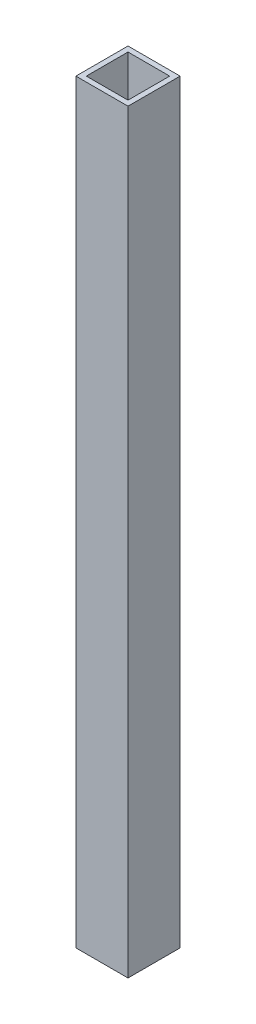
from build123d import *

# Parameters (mm, degrees)
SKETCH1_W           = 15
SKETCH1_H           = 15
SKETCH1_W_2         = 12
SKETCH1_H_2         = 12
EXTRUDE_THIN1_DEPTH = 217.3


with BuildPart() as part:
    # Sketch1 → Extrude-Thin1 (new body)
    with BuildSketch(Plane(origin=(0, 0, 0), x_dir=(1, 0, 0), z_dir=(0, 1, 0))):
        with Locations((7.5, 7.5)):
            Rectangle(SKETCH1_W, SKETCH1_H)
        with Locations((7.5, 7.5)):
            Rectangle(SKETCH1_W_2, SKETCH1_H_2, mode=Mode.SUBTRACT)
    extrude(amount=EXTRUDE_THIN1_DEPTH)


solid = part.part
